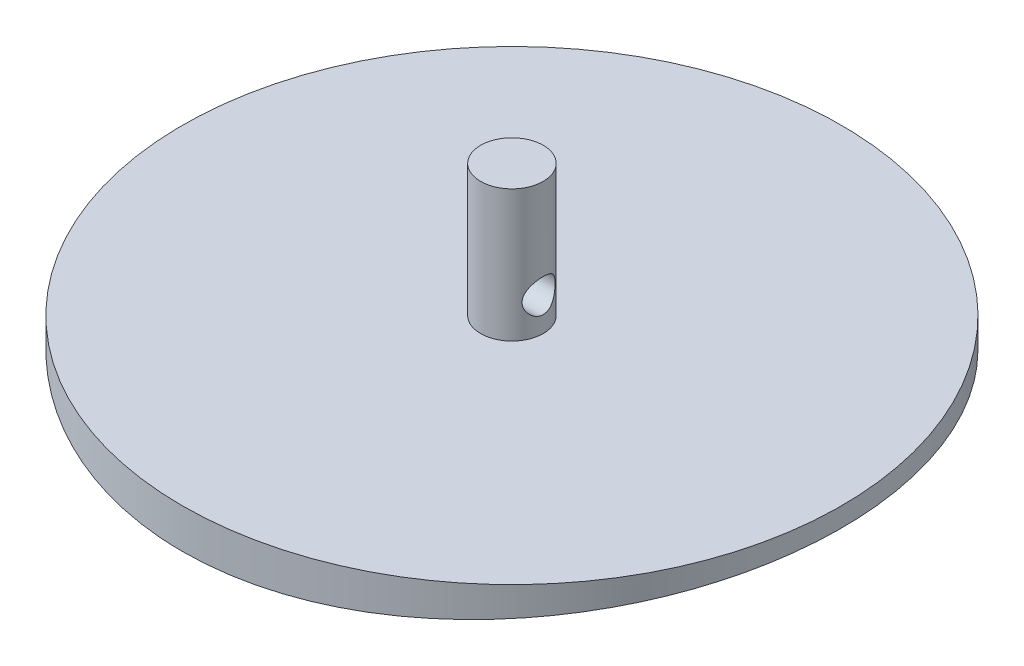
from build123d import *

# Parameters (mm, degrees)
SKETCH1_R                      = 50
BOSS_EXTRUDE1_DEPTH            = 6
SKETCH2_R                      = 4.75
BOSS_EXTRUDE2_DEPTH            = 20
CUT_EXTRUDE1_REACH             = 80.572
SKETCH3_R                      = 2.5
CUT_EXTRUDE2_REACH             = 77.339
CUT_EXTRUDE2_DIRECTION_2_REACH = 77.339


with BuildPart() as part:
    # Sketch1 → Boss-Extrude1 (new body)
    with BuildSketch(Plane(origin=(0, 0, 0), x_dir=(1, 0, 0), z_dir=(0, 1, 0))):
        Circle(SKETCH1_R)
    extrude(amount=BOSS_EXTRUDE1_DEPTH)

    # Sketch2 → Boss-Extrude2 (add)
    with BuildSketch(Plane(origin=(0, 6, 0), x_dir=(1, 0, 0), z_dir=(0, 1, 0))):
        Circle(SKETCH2_R)
    extrude(amount=BOSS_EXTRUDE2_DEPTH)

    # Sketch3 → Cut-Extrude1 (cut, up to next)
    with BuildSketch(Plane(origin=(4.75, 0, 0), x_dir=(0, 0, -1), z_dir=(1, 0, 0)), mode=Mode.PRIVATE) as cut_extrude1_sk1:
        with Locations((0, 11)):
            Circle(SKETCH3_R)
    cut_extrude1_tool1 = extrude(cut_extrude1_sk1.sketch, amount=-CUT_EXTRUDE1_REACH, mode=Mode.PRIVATE) & part.part
    add(cut_extrude1_tool1.solids().sort_by_distance((4.75, 11, 0))[0], mode=Mode.SUBTRACT)

    # Sketch4 → Cut-Extrude2 (cut, up to next)
    with BuildSketch(Plane(origin=(0, 0, 0), x_dir=(0, 0, -1), z_dir=(1, 0, 0)), mode=Mode.PRIVATE) as cut_extrude2_sk1:
        with BuildLine():
            Line((-50, 0), (50, 0))
            ThreePointArc((50, 0), (0, 3.066817318), (-50, 0))
        make_face()
    cut_extrude2_tool1 = extrude(cut_extrude2_sk1.sketch, amount=-CUT_EXTRUDE2_REACH, mode=Mode.PRIVATE) & part.part
    add(cut_extrude2_tool1.solids().sort_by_distance((0, 1.227122, 0))[0], mode=Mode.SUBTRACT)

    # Sketch4 → Cut-Extrude2 direction 2 (cut, up to next)
    with BuildSketch(Plane(origin=(0, 0, 0), x_dir=(0, 0, -1), z_dir=(1, 0, 0)), mode=Mode.PRIVATE) as cut_extrude2_direction_2_sk1:
        with BuildLine():
            Line((-50, 0), (50, 0))
            ThreePointArc((50, 0), (0, 3.066817318), (-50, 0))
        make_face()
    cut_extrude2_direction_2_tool1 = extrude(cut_extrude2_direction_2_sk1.sketch, amount=CUT_EXTRUDE2_DIRECTION_2_REACH, mode=Mode.PRIVATE) & part.part
    add(cut_extrude2_direction_2_tool1.solids().sort_by_distance((0, 1.227122, 0))[0], mode=Mode.SUBTRACT)


solid = part.part
